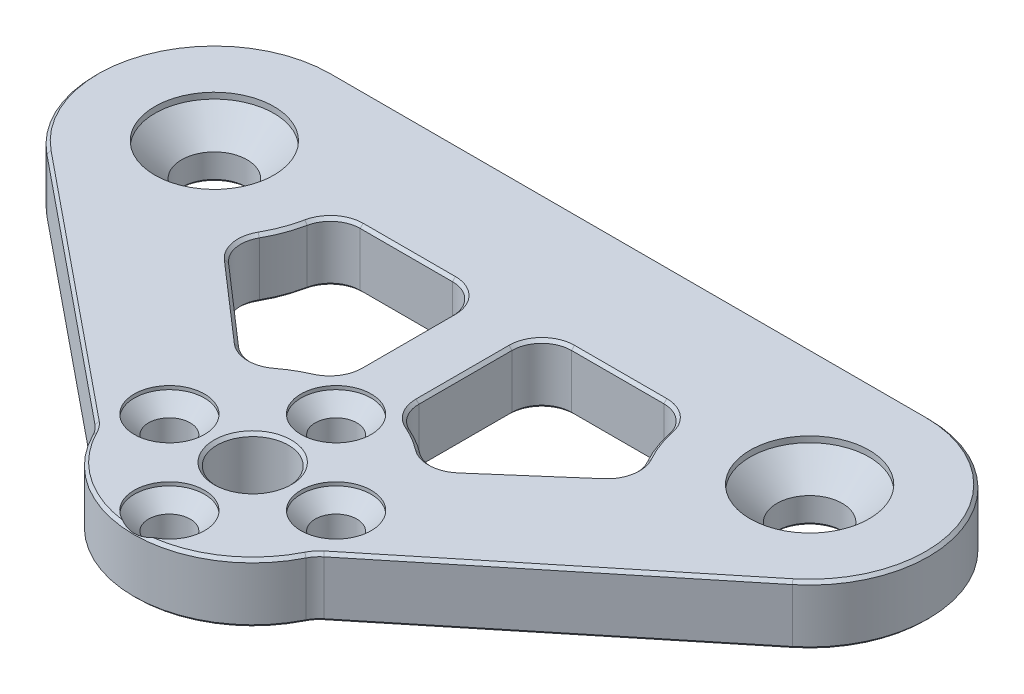
from build123d import *

# Parameters (mm, degrees)
SKETCH1_R                                      = 1.75
SKETCH1_R_2                                    = 3
SKETCH1_R_3                                    = 2.75
BOSS_EXTRUDE1_DEPTH                            = 5
CSK_FOR_M3_FLAT_HEAD_MACHINE_SCREW2_AT_2_COUNT = 2
CSK_FOR_M3_FLAT_HEAD_MACHINE_SCREW2_AT_2_PITCH = 9.899494937
CSK_FOR_M3_FLAT_HEAD_MACHINE_SCREW2_AT_3_COUNT = 2
CSK_FOR_M3_FLAT_HEAD_MACHINE_SCREW2_AT_3_PITCH = 14
CSK_FOR_M3_FLAT_HEAD_MACHINE_SCREW2_AT_4_COUNT = 2
CSK_FOR_M3_FLAT_HEAD_MACHINE_SCREW2_AT_4_PITCH = 9.899494937
CSK_FOR_M5_FLAT_HEAD_MACHINE_SCREW1_AT_2_COUNT = 2
CSK_FOR_M5_FLAT_HEAD_MACHINE_SCREW1_AT_2_PITCH = 50
CUT_EXTRUDE1_REACH                             = 49.538
FILLET1_R                                      = 2.5
CHAMFER1_SIZE                                  = 0.25


with BuildPart() as part:
    # Sketch1 → Boss-Extrude1 (new body)
    with BuildSketch(Plane(origin=(0, 0, 0), x_dir=(1, 0, 0), z_dir=(0, 1, 0))):
        with BuildLine():
            Line((-31.31164637, 14.021149308), (-9.16515139, -4))
            ThreePointArc((-9.16515139, -4), (0, -10), (9.16515139, -4))
            Line((9.16515139, -4), (31.31164637, 14.021149308))
            ThreePointArc((31.31164637, 14.021149308), (34.422443659, 25.126900143), (25, 31.777638212))
            Line((25, 31.777638212), (-25, 31.777638212))
            ThreePointArc((-25, 31.777638212), (-34.422443659, 25.126900143), (-31.31164637, 14.021149308))
        make_face()
        with Locations(Location((0, 7, 0), (0, 0, 270))):
            Circle(SKETCH1_R, mode=Mode.SUBTRACT)
        with Locations(Location((7, 0, 0), (0, 0, 270))):
            Circle(SKETCH1_R, mode=Mode.SUBTRACT)
        with Locations(Location((0, -7, 0), (0, 0, 270))):
            Circle(SKETCH1_R, mode=Mode.SUBTRACT)
        with Locations(Location((-7, 0, 0), (0, 0, 270))):
            Circle(SKETCH1_R, mode=Mode.SUBTRACT)
        with Locations(Location((0, 0, 0), (0, 0, 270))):
            Circle(SKETCH1_R_2, mode=Mode.SUBTRACT)
        with Locations(Location((-25, 21.777638212, 0), (0, 0, 270))):
            Circle(SKETCH1_R_3, mode=Mode.SUBTRACT)
        with Locations(Location((25, 21.777638212, 0), (0, 0, 90))):
            Circle(SKETCH1_R_3, mode=Mode.SUBTRACT)
    extrude(amount=BOSS_EXTRUDE1_DEPTH)

    # Sketch3 → CSK for M3 Flat Head Machine Screw2 (revolve, cut)
    with BuildSketch(Plane(origin=(0, 5, -7), x_dir=(0, 0, 1), z_dir=(1, 0, 0))):
        Polygon((0, 0), (0, 5), (1.75, 5), (1.75, 1.5), (2.95, 0.3), (2.95, 0), align=None)
    csk_for_m3_flat_head_machine_screw2 = revolve(axis=Axis((0, 11.35, -7), (0, -1, 0)), mode=Mode.SUBTRACT)

    # CSK for M3 Flat Head Machine Screw2 at 2: CSK for M3 Flat Head Machine Screw2 ×2
    with Locations(*[Vector(0.7071067811865479, 0, 0.7071067811865472) * (i * CSK_FOR_M3_FLAT_HEAD_MACHINE_SCREW2_AT_2_PITCH) for i in range(1, CSK_FOR_M3_FLAT_HEAD_MACHINE_SCREW2_AT_2_COUNT)]):
        add(csk_for_m3_flat_head_machine_screw2, mode=Mode.SUBTRACT)

    # CSK for M3 Flat Head Machine Screw2 at 3: CSK for M3 Flat Head Machine Screw2 ×2
    with Locations(*[(0, 0, i * CSK_FOR_M3_FLAT_HEAD_MACHINE_SCREW2_AT_3_PITCH) for i in range(1, CSK_FOR_M3_FLAT_HEAD_MACHINE_SCREW2_AT_3_COUNT)]):
        add(csk_for_m3_flat_head_machine_screw2, mode=Mode.SUBTRACT)

    # CSK for M3 Flat Head Machine Screw2 at 4: CSK for M3 Flat Head Machine Screw2 ×2
    with Locations(*[Vector(-0.7071067811865476, 0, 0.7071067811865476) * (i * CSK_FOR_M3_FLAT_HEAD_MACHINE_SCREW2_AT_4_PITCH) for i in range(1, CSK_FOR_M3_FLAT_HEAD_MACHINE_SCREW2_AT_4_COUNT)]):
        add(csk_for_m3_flat_head_machine_screw2, mode=Mode.SUBTRACT)

    # Sketch5 → CSK for M5 Flat Head Machine Screw1 (revolve, cut)
    with BuildSketch(Plane(origin=(-25, 5, -21.777638212), x_dir=(0, 0, 1), z_dir=(1, 0, 0))):
        Polygon((0, 0), (0, 5), (2.75, 5), (2.75, 2.75), (5, 0.5), (5, 0), align=None)
    csk_for_m5_flat_head_machine_screw1 = revolve(axis=Axis((-25, 11.35, -21.777638212), (0, -1, 0)), mode=Mode.SUBTRACT)

    # CSK for M5 Flat Head Machine Screw1 at 2: CSK for M5 Flat Head Machine Screw1 ×2
    with Locations(*[(i * CSK_FOR_M5_FLAT_HEAD_MACHINE_SCREW1_AT_2_PITCH, 0, 0) for i in range(1, CSK_FOR_M5_FLAT_HEAD_MACHINE_SCREW1_AT_2_COUNT)]):
        add(csk_for_m5_flat_head_machine_screw1, mode=Mode.SUBTRACT)

    # Sketch6 → Cut-Extrude1 (cut, up to next)
    with BuildSketch(Plane(origin=(0, 5, 0), x_dir=(1, 0, 0), z_dir=(0, 1, 0)), mode=Mode.PRIVATE) as cut_extrude1_sk1:
        with BuildLine():
            Line((-2.5, 21.777638212), (-15, 21.777638212))
            ThreePointArc((-15, 21.777638212), (-15.635091731, 18.270717467), (-17.459698622, 15.209239995))
            Line((-17.459698622, 15.209239995), (-7.540301378, 6.568398217))
            ThreePointArc((-7.540301378, 6.568398217), (-5.256068454, 8.507275969), (-2.5, 9.682458366))
            Line((-2.5, 9.682458366), (-2.5, 21.777638212))
        make_face()
    cut_extrude1_tool1 = extrude(cut_extrude1_sk1.sketch, amount=-CUT_EXTRUDE1_REACH, mode=Mode.PRIVATE) & part.part
    # Sketch6 → Cut-Extrude1 (cut, up to next)
    with BuildSketch(Plane(origin=(0, 5, 0), x_dir=(1, 0, 0), z_dir=(0, 1, 0)), mode=Mode.PRIVATE) as cut_extrude1_sk2:
        with BuildLine():
            Line((15, 21.777638212), (2.5, 21.777638212))
            Line((2.5, 21.777638212), (2.5, 9.682458366))
            ThreePointArc((2.5, 9.682458366), (5.256068454, 8.507275969), (7.540301378, 6.568398217))
            Line((7.540301378, 6.568398217), (17.459698622, 15.209239995))
            ThreePointArc((17.459698622, 15.209239995), (15.635091731, 18.270717467), (15, 21.777638212))
        make_face()
    cut_extrude1_tool2 = extrude(cut_extrude1_sk2.sketch, amount=-CUT_EXTRUDE1_REACH, mode=Mode.PRIVATE) & part.part
    add(cut_extrude1_tool1.solids().sort_by_distance((-8.781839, 5, -15.442168))[0], mode=Mode.SUBTRACT)
    add(cut_extrude1_tool2.solids().sort_by_distance((8.781839, 5, -15.442168))[0], mode=Mode.SUBTRACT)

    # Fillet1
    fillet1_edges = [part.edges().sort_by_distance(p)[0] for p in [
        (-17.459698622, 2.5, -15.209239995),
        (-15, 2.5, -21.777638212),
        (-2.5, 2.5, -21.777638212),
        (-2.5, 2.5, -9.682458366),
        (-7.540301378, 2.5, -6.568398217),
        (9.16515139, 2.5, 4),
        (17.459698622, 2.5, -15.209239995),
        (-9.16515139, 2.5, 4),
        (7.540301378, 2.5, -6.568398217),
        (2.5, 2.5, -9.682458366),
        (2.5, 2.5, -21.777638212),
        (15, 2.5, -21.777638212),
    ]]
    fillet(fillet1_edges, radius=FILLET1_R)

    # Chamfer1
    # the kernel refuses this chamfer: 0.25 mm, written as the material it takes off along each edge
    with BuildSketch(Plane(origin=(9.608207523, 0, 3.639474295), x_dir=(-0.6309260042751522, -0.027495876610586438, -0.7753556305972157), z_dir=(0.7756488903254193, 0, -0.6311646369505708)), Plane(origin=(-31.31164637, 5, -14.021149308), x_dir=(-0.017354424978555043, -0.999621916911297, 0.02132714618152181), z_dir=(0.7756488903254194, 0, 0.6311646369505706))) as chamfer1_piece_1:
        Polygon((CHAMFER1_SIZE * 0.999621916911, CHAMFER1_SIZE * 0.0274958766106), (-CHAMFER1_SIZE * 0.0274958766106, CHAMFER1_SIZE * 0.999621916911), (0, 0), align=None)
    extrude(amount=27.981009342, mode=Mode.SUBTRACT)
    with BuildSketch(Plane(origin=(9.608207523, 5, 3.639474295), x_dir=(-0.6309260042751522, 0.02749587661058563, -0.7753556305972157), z_dir=(0.7756488903254193, 0, -0.6311646369505708)), Plane(origin=(-31.31164637, 0, -14.021149308), x_dir=(-0.01735442497855503, 0.9996219169112968, 0.021327146181521792), z_dir=(0.7756488903254194, 0, 0.6311646369505706))) as chamfer1_piece_2:
        Polygon((CHAMFER1_SIZE * 0.999621916911, -CHAMFER1_SIZE * 0.0274958766106), (-CHAMFER1_SIZE * 0.0274958766106, -CHAMFER1_SIZE * 0.999621916911), (0, 0), align=None)
    extrude(amount=27.981009342, mode=Mode.SUBTRACT)
    with BuildSketch(Plane(origin=(0, 0, 0), x_dir=(-0.8948895292297137, 0, 0.44628772162700336), z_dir=(-0.44628772162700336, 0, -0.8948895292297137))) as chamfer1_piece_3:
        Polygon((10 - CHAMFER1_SIZE, 0), (10, CHAMFER1_SIZE), (10, 0), align=None)
    revolve(axis=Axis((0, 0, 0), (0, 1, 0)), revolution_arc=126.988487407, mode=Mode.SUBTRACT)
    with BuildSketch(Plane(origin=(0, 5, 0), x_dir=(-0.8948895292297137, 0, 0.44628772162700336), z_dir=(-0.44628772162700336, 0, -0.8948895292297137))) as chamfer1_piece_4:
        Polygon((10 - CHAMFER1_SIZE, 0), (10, -CHAMFER1_SIZE), (10, 0), align=None)
    revolve(axis=Axis((0, 5, 0), (0, 1, 0)), revolution_arc=126.988487407, mode=Mode.SUBTRACT)
    with BuildSketch(Plane(origin=(12.752551286, 5, -21.777638212), x_dir=(0, 0.02749587661058574, -0.9996219169112968), z_dir=(-1, 0, 0)), Plane(origin=(5, 0, -21.777638212), x_dir=(0, -0.027495876610586483, -0.9996219169112968), z_dir=(1, 0, 0)), Plane(origin=(-5, 5, -21.777638212), x_dir=(0, 0.02749587661058574, -0.9996219169112968), z_dir=(-1, 0, 0)), Plane(origin=(-12.752551286, 0, -21.777638212), x_dir=(0, -0.027495876610586483, -0.9996219169112968), z_dir=(1, 0, 0))) as chamfer1_piece_5:
        Polygon((CHAMFER1_SIZE * 0.999621916911, CHAMFER1_SIZE * 0.0274958766106), (-CHAMFER1_SIZE * 0.0274958766106, CHAMFER1_SIZE * 0.999621916911), (0, 0), align=None)
    extrude(amount=7.752551286, mode=Mode.SUBTRACT)
    with BuildSketch(Plane(origin=(25, 0, -21.777638212), x_dir=(-0.9797958971132712, 0, 0.2000000000000005), z_dir=(-0.2000000000000005, 0, -0.9797958971132712))) as chamfer1_piece_6:
        Polygon((10 - CHAMFER1_SIZE, 0), (10, CHAMFER1_SIZE), (10, 0), align=None)
    revolve(axis=Axis((25, 0, -21.777638212), (0, 1, 0)), revolution_arc=17.985384569, mode=Mode.SUBTRACT)
    with BuildSketch(Plane(origin=(25, 5, -21.777638212), x_dir=(-0.8701635996316405, 0, 0.49276293476285926), z_dir=(0.49276293476285926, 0, 0.8701635996316405))) as chamfer1_piece_7:
        Polygon((10 - CHAMFER1_SIZE, 0), (10, CHAMFER1_SIZE), (10, 0), align=None)
    revolve(axis=Axis((25, 5, -21.777638212), (0, -1, 0)), revolution_arc=17.985384569, mode=Mode.SUBTRACT)
    with BuildSketch(Plane(origin=(9.234945441, 5, -8.044612029), x_dir=(0.656591481627917, 0.02749587661058574, 0.7537450517403561), z_dir=(0.7540301377838249, 0, -0.6568398216564723)), Plane(origin=(15.765054559, 0, -13.733026183), x_dir=(0.656591481627917, -0.027495876610584825, 0.7537450517403561), z_dir=(-0.7540301377838249, 0, 0.6568398216564723)), Plane(origin=(-15.765054559, 5, -13.733026183), x_dir=(-0.656591481627917, 0.02749587661058574, 0.7537450517403562), z_dir=(0.7540301377838249, 0, 0.6568398216564721)), Plane(origin=(-9.234945441, 0, -8.044612029), x_dir=(-0.656591481627917, -0.027495876610586414, 0.7537450517403562), z_dir=(-0.7540301377838249, 0, -0.6568398216564721))) as chamfer1_piece_8:
        Polygon((CHAMFER1_SIZE * 0.999621916911, CHAMFER1_SIZE * 0.0274958766106), (-CHAMFER1_SIZE * 0.0274958766106, CHAMFER1_SIZE * 0.999621916911), (0, 0), align=None)
    extrude(amount=8.660276016, mode=Mode.SUBTRACT)
    with BuildSketch(Plane(origin=(0, 5, 0), x_dir=(0.4000000000000007, 0, -0.9165151389911678), z_dir=(-0.9165151389911678, 0, -0.4000000000000007))) as chamfer1_piece_9:
        Polygon((10 - CHAMFER1_SIZE, 0), (10, CHAMFER1_SIZE), (10, 0), align=None)
    revolve(axis=Axis((0, 5, 0), (0, -1, 0)), revolution_arc=13.825559854, mode=Mode.SUBTRACT)
    with BuildSketch(Plane(origin=(0, 0, 0), x_dir=(0.6074276709690519, 0, -0.7943749898763891), z_dir=(0.7943749898763891, 0, 0.6074276709690519))) as chamfer1_piece_10:
        Polygon((10 - CHAMFER1_SIZE, 0), (10, CHAMFER1_SIZE), (10, 0), align=None)
    revolve(axis=Axis((0, 0, 0), (0, 1, 0)), revolution_arc=13.825559854, mode=Mode.SUBTRACT)
    with BuildSketch(Plane(origin=(2.5, 5, -19.277638212), x_dir=(-0.9996219169112968, 0.027495876610585647, 0), z_dir=(0, 0, 1)), Plane(origin=(2.5, 0, -11.456439237), x_dir=(-0.9996219169112968, -0.02749587661058639, 0), z_dir=(0, 0, -1)), Plane(origin=(-2.5, 0, -19.277638212), x_dir=(0.9996219169112968, -0.02749587661058639, 0), z_dir=(0, 0, 1)), Plane(origin=(-2.5, 5, -11.456439237), x_dir=(0.9996219169112968, 0.027495876610585647, 0), z_dir=(0, 0, -1))) as chamfer1_piece_11:
        Polygon((CHAMFER1_SIZE * 0.999621916911, CHAMFER1_SIZE * 0.0274958766106), (-CHAMFER1_SIZE * 0.0274958766106, CHAMFER1_SIZE * 0.999621916911), (0, 0), align=None)
    extrude(amount=7.821198974, mode=Mode.SUBTRACT)
    with BuildSketch(Plane(origin=(0, 5, 0), x_dir=(-0.6074276709690513, 0, -0.7943749898763894), z_dir=(-0.7943749898763894, 0, 0.6074276709690513))) as chamfer1_piece_12:
        Polygon((10 - CHAMFER1_SIZE, 0), (10, CHAMFER1_SIZE), (10, 0), align=None)
    revolve(axis=Axis((0, 5, 0), (0, -1, 0)), revolution_arc=13.825559854, mode=Mode.SUBTRACT)
    with BuildSketch(Plane(origin=(0, 0, 0), x_dir=(-0.4000000000000002, 0, -0.9165151389911679), z_dir=(0.9165151389911679, 0, -0.4000000000000002))) as chamfer1_piece_13:
        Polygon((10 - CHAMFER1_SIZE, 0), (10, CHAMFER1_SIZE), (10, 0), align=None)
    revolve(axis=Axis((0, 0, 0), (0, 1, 0)), revolution_arc=13.825559854, mode=Mode.SUBTRACT)
    with BuildSketch(Plane(origin=(-25, 5, -21.777638212), x_dir=(0.9797958971132713, 0, 0.19999999999999968), z_dir=(0.19999999999999968, 0, -0.9797958971132713))) as chamfer1_piece_14:
        Polygon((10 - CHAMFER1_SIZE, 0), (10, CHAMFER1_SIZE), (10, 0), align=None)
    revolve(axis=Axis((-25, 5, -21.777638212), (0, -1, 0)), revolution_arc=17.985384569, mode=Mode.SUBTRACT)
    with BuildSketch(Plane(origin=(-25, 0, -21.777638212), x_dir=(0.8701635996316408, 0, 0.49276293476285904), z_dir=(-0.49276293476285904, 0, 0.8701635996316408))) as chamfer1_piece_15:
        Polygon((10 - CHAMFER1_SIZE, 0), (10, CHAMFER1_SIZE), (10, 0), align=None)
    revolve(axis=Axis((-25, 0, -21.777638212), (0, 1, 0)), revolution_arc=17.985384569, mode=Mode.SUBTRACT)
    with BuildSketch(Plane(origin=(11.186119115, 0, 5.57859652), x_dir=(-0.8948895292297134, 0, -0.4462877216270036), z_dir=(-0.4462877216270036, 0, 0.8948895292297134))) as chamfer1_piece_16:
        Polygon((2.5 + CHAMFER1_SIZE, 0), (2.5, -CHAMFER1_SIZE), (2.5, 0), align=None)
    revolve(axis=Axis((11.186119115, 0, 5.57859652), (0, -1, 0)), revolution_arc=24.358144003, mode=Mode.SUBTRACT)
    with BuildSketch(Plane(origin=(11.186119115, 5, 5.57859652), x_dir=(-0.8948895292297134, 0, -0.4462877216270036), z_dir=(-0.4462877216270036, 0, 0.8948895292297134))) as chamfer1_piece_17:
        Polygon((2.5 + CHAMFER1_SIZE, 0), (2.5, CHAMFER1_SIZE), (2.5, 0), align=None)
    revolve(axis=Axis((11.186119115, 5, 5.57859652), (0, -1, 0)), revolution_arc=24.358144003, mode=Mode.SUBTRACT)
    with BuildSketch(Plane(origin=(-11.186119115, 0, 5.57859652), x_dir=(0.6311646369505725, 0, -0.7756488903254177), z_dir=(-0.7756488903254177, 0, -0.6311646369505725))) as chamfer1_piece_18:
        Polygon((2.5 + CHAMFER1_SIZE, 0), (2.5, -CHAMFER1_SIZE), (2.5, 0), align=None)
    revolve(axis=Axis((-11.186119115, 0, 5.57859652), (0, -1, 0)), revolution_arc=24.358144003, mode=Mode.SUBTRACT)
    with BuildSketch(Plane(origin=(-11.186119115, 5, 5.57859652), x_dir=(0.6311646369505725, 0, -0.7756488903254177), z_dir=(-0.7756488903254177, 0, -0.6311646369505725))) as chamfer1_piece_19:
        Polygon((2.5, CHAMFER1_SIZE), (2.5 + CHAMFER1_SIZE, 0), (2.5, 0), align=None)
    revolve(axis=Axis((-11.186119115, 5, 5.57859652), (0, -1, 0)), revolution_arc=24.358144003, mode=Mode.SUBTRACT)
    with BuildSketch(Plane(origin=(12.752551286, 5, -19.277638212), x_dir=(0.979795897113271, 0, -0.20000000000000145), z_dir=(0.20000000000000145, 0, 0.979795897113271))) as chamfer1_piece_20:
        Polygon((2.5 + CHAMFER1_SIZE, 0), (2.5, -CHAMFER1_SIZE), (2.5, 0), align=None)
    revolve(axis=Axis((12.752551286, 5, -19.277638212), (0, 1, 0)), revolution_arc=78.463040967, mode=Mode.SUBTRACT)
    with BuildSketch(Plane(origin=(12.752551286, 0, -19.277638212), x_dir=(0.979795897113271, 0, -0.20000000000000145), z_dir=(0.20000000000000145, 0, 0.979795897113271))) as chamfer1_piece_21:
        Polygon((2.5 + CHAMFER1_SIZE, 0), (2.5, CHAMFER1_SIZE), (2.5, 0), align=None)
    revolve(axis=Axis((12.752551286, 0, -19.277638212), (0, 1, 0)), revolution_arc=78.463040967, mode=Mode.SUBTRACT)
    with BuildSketch(Plane(origin=(14.122955005, 5, -15.618101527), x_dir=(0.870163599631641, 0, -0.4927629347628583), z_dir=(-0.4927629347628583, 0, -0.870163599631641))) as chamfer1_piece_22:
        Polygon((2.5 + CHAMFER1_SIZE, 0), (2.5, CHAMFER1_SIZE), (2.5, 0), align=None)
    revolve(axis=Axis((14.122955005, 5, -15.618101527), (0, -1, 0)), revolution_arc=78.463040967, mode=Mode.SUBTRACT)
    with BuildSketch(Plane(origin=(14.122955005, 0, -15.618101527), x_dir=(0.870163599631641, 0, -0.4927629347628583), z_dir=(-0.4927629347628583, 0, -0.870163599631641))) as chamfer1_piece_23:
        Polygon((2.5 + CHAMFER1_SIZE, 0), (2.5, -CHAMFER1_SIZE), (2.5, 0), align=None)
    revolve(axis=Axis((14.122955005, 0, -15.618101527), (0, -1, 0)), revolution_arc=78.463040967, mode=Mode.SUBTRACT)
    with BuildSketch(Plane(origin=(7.592845887, 5, -9.929687373), x_dir=(-0.6074276709690517, 0, 0.7943749898763892), z_dir=(-0.7943749898763892, 0, -0.6074276709690517))) as chamfer1_piece_24:
        Polygon((2.5 + CHAMFER1_SIZE, 0), (2.5, -CHAMFER1_SIZE), (2.5, 0), align=None)
    revolve(axis=Axis((7.592845887, 5, -9.929687373), (0, 1, 0)), revolution_arc=78.463040967, mode=Mode.SUBTRACT)
    with BuildSketch(Plane(origin=(7.592845887, 0, -9.929687373), x_dir=(-0.6074276709690516, 0, 0.7943749898763894), z_dir=(-0.7943749898763894, 0, -0.6074276709690516))) as chamfer1_piece_25:
        Polygon((2.5 + CHAMFER1_SIZE, 0), (2.5, CHAMFER1_SIZE), (2.5, 0), align=None)
    revolve(axis=Axis((7.592845887, 0, -9.929687373), (0, 1, 0)), revolution_arc=78.463040967, mode=Mode.SUBTRACT)
    with BuildSketch(Plane(origin=(5, 5, -11.456439237), x_dir=(-1, 0, 0), z_dir=(0, 0, -1))) as chamfer1_piece_26:
        Polygon((2.5 + CHAMFER1_SIZE, 0), (2.5, -CHAMFER1_SIZE), (2.5, 0), align=None)
    revolve(axis=Axis((5, 5, -11.456439237), (0, 1, 0)), revolution_arc=66.421821522, mode=Mode.SUBTRACT)
    with BuildSketch(Plane(origin=(5, 0, -11.456439237), x_dir=(-1, 0, 0), z_dir=(0, 0, -1))) as chamfer1_piece_27:
        Polygon((2.5 + CHAMFER1_SIZE, 0), (2.5, CHAMFER1_SIZE), (2.5, 0), align=None)
    revolve(axis=Axis((5, 0, -11.456439237), (0, 1, 0)), revolution_arc=66.421821522, mode=Mode.SUBTRACT)
    with BuildSketch(Plane(origin=(5, 5, -19.277638212), x_dir=(0, 0, -1), z_dir=(1, 0, 0))) as chamfer1_piece_28:
        Polygon((2.5 + CHAMFER1_SIZE, 0), (2.5, -CHAMFER1_SIZE), (2.5, 0), align=None)
    revolve(axis=Axis((5, 5, -19.277638212), (0, 1, 0)), revolution_arc=90, mode=Mode.SUBTRACT)
    with BuildSketch(Plane(origin=(5, 0, -19.277638212), x_dir=(0, 0, -1), z_dir=(1, 0, 0))) as chamfer1_piece_29:
        Polygon((2.5 + CHAMFER1_SIZE, 0), (2.5, CHAMFER1_SIZE), (2.5, 0), align=None)
    revolve(axis=Axis((5, 0, -19.277638212), (0, 1, 0)), revolution_arc=90, mode=Mode.SUBTRACT)
    with BuildSketch(Plane(origin=(-5, 5, -19.277638212), x_dir=(0, 0, -1), z_dir=(-1, 0, 0))) as chamfer1_piece_30:
        Polygon((2.5 + CHAMFER1_SIZE, 0), (2.5, CHAMFER1_SIZE), (2.5, 0), align=None)
    revolve(axis=Axis((-5, 5, -19.277638212), (0, -1, 0)), revolution_arc=90, mode=Mode.SUBTRACT)
    with BuildSketch(Plane(origin=(-5, 0, -19.277638212), x_dir=(0, 0, -1), z_dir=(-1, 0, 0))) as chamfer1_piece_31:
        Polygon((2.5 + CHAMFER1_SIZE, 0), (2.5, -CHAMFER1_SIZE), (2.5, 0), align=None)
    revolve(axis=Axis((-5, 0, -19.277638212), (0, -1, 0)), revolution_arc=90, mode=Mode.SUBTRACT)
    with BuildSketch(Plane(origin=(0, 0, -7), x_dir=(0, 0, 1), z_dir=(-1, 0, 0))) as chamfer1_piece_32:
        Polygon((1.75 + CHAMFER1_SIZE, 0), (1.75, CHAMFER1_SIZE), (1.75, 0), align=None)
    revolve(axis=Axis((0, 0, -7), (0, 1, 0)), mode=Mode.SUBTRACT)
    with BuildSketch(Plane(origin=(-5, 5, -11.456439237), x_dir=(0.40000000000000024, 0, 0.916515138991168), z_dir=(-0.916515138991168, 0, 0.40000000000000024))) as chamfer1_piece_33:
        Polygon((2.5 + CHAMFER1_SIZE, 0), (2.5, -CHAMFER1_SIZE), (2.5, 0), align=None)
    revolve(axis=Axis((-5, 5, -11.456439237), (0, 1, 0)), revolution_arc=66.421821522, mode=Mode.SUBTRACT)
    with BuildSketch(Plane(origin=(-5, 0, -11.456439237), x_dir=(0.4000000000000005, 0, 0.9165151389911678), z_dir=(-0.9165151389911678, 0, 0.4000000000000005))) as chamfer1_piece_34:
        Polygon((2.5 + CHAMFER1_SIZE, 0), (2.5, CHAMFER1_SIZE), (2.5, 0), align=None)
    revolve(axis=Axis((-5, 0, -11.456439237), (0, 1, 0)), revolution_arc=66.421821522, mode=Mode.SUBTRACT)
    with BuildSketch(Plane(origin=(-7.592845887, 5, -9.929687373), x_dir=(-0.6568398216564721, 0, 0.7540301377838249), z_dir=(-0.7540301377838249, 0, -0.6568398216564721))) as chamfer1_piece_35:
        Polygon((2.5 + CHAMFER1_SIZE, 0), (2.5, -CHAMFER1_SIZE), (2.5, 0), align=None)
    revolve(axis=Axis((-7.592845887, 5, -9.929687373), (0, 1, 0)), revolution_arc=78.463040967, mode=Mode.SUBTRACT)
    with BuildSketch(Plane(origin=(-7.592845887, 0, -9.929687373), x_dir=(-0.6568398216564725, 0, 0.7540301377838244), z_dir=(-0.7540301377838244, 0, -0.6568398216564725))) as chamfer1_piece_36:
        Polygon((2.5 + CHAMFER1_SIZE, 0), (2.5, CHAMFER1_SIZE), (2.5, 0), align=None)
    revolve(axis=Axis((-7.592845887, 0, -9.929687373), (0, 1, 0)), revolution_arc=78.463040967, mode=Mode.SUBTRACT)
    with BuildSketch(Plane(origin=(-14.122955005, 5, -15.618101527), x_dir=(-0.8701635996316401, 0, -0.4927629347628601), z_dir=(0.4927629347628601, 0, -0.8701635996316401))) as chamfer1_piece_37:
        Polygon((2.5 + CHAMFER1_SIZE, 0), (2.5, -CHAMFER1_SIZE), (2.5, 0), align=None)
    revolve(axis=Axis((-14.122955005, 5, -15.618101527), (0, 1, 0)), revolution_arc=78.463040967, mode=Mode.SUBTRACT)
    with BuildSketch(Plane(origin=(-14.122955005, 0, -15.618101527), x_dir=(-0.8701635996316401, 0, -0.4927629347628601), z_dir=(0.4927629347628601, 0, -0.8701635996316401))) as chamfer1_piece_38:
        Polygon((2.5 + CHAMFER1_SIZE, 0), (2.5, CHAMFER1_SIZE), (2.5, 0), align=None)
    revolve(axis=Axis((-14.122955005, 0, -15.618101527), (0, 1, 0)), revolution_arc=78.463040967, mode=Mode.SUBTRACT)
    with BuildSketch(Plane(origin=(-12.752551286, 5, -19.277638212), x_dir=(0, 0, -1), z_dir=(1, 0, 0))) as chamfer1_piece_39:
        Polygon((2.5 + CHAMFER1_SIZE, 0), (2.5, -CHAMFER1_SIZE), (2.5, 0), align=None)
    revolve(axis=Axis((-12.752551286, 5, -19.277638212), (0, 1, 0)), revolution_arc=78.463040967, mode=Mode.SUBTRACT)
    with BuildSketch(Plane(origin=(-12.752551286, 0, -19.277638212), x_dir=(0, 0, -1), z_dir=(1, 0, 0))) as chamfer1_piece_40:
        Polygon((2.5 + CHAMFER1_SIZE, 0), (2.5, CHAMFER1_SIZE), (2.5, 0), align=None)
    revolve(axis=Axis((-12.752551286, 0, -19.277638212), (0, 1, 0)), revolution_arc=78.463040967, mode=Mode.SUBTRACT)
    with BuildSketch(Plane(origin=(7, 0, 0), x_dir=(0, 0, 1), z_dir=(-1, 0, 0))) as chamfer1_piece_41:
        Polygon((1.75 + CHAMFER1_SIZE, 0), (1.75, CHAMFER1_SIZE), (1.75, 0), align=None)
    revolve(axis=Axis((7, 0, 0), (0, 1, 0)), mode=Mode.SUBTRACT)
    with BuildSketch(Plane(origin=(25, 5, -21.777638212), x_dir=(0.6311646369505718, 0, 0.7756488903254183), z_dir=(-0.7756488903254183, 0, 0.6311646369505718))) as chamfer1_piece_42:
        Polygon((10 - CHAMFER1_SIZE, 0), (10, -CHAMFER1_SIZE), (10, 0), align=None)
    revolve(axis=Axis((25, 5, -21.777638212), (0, 1, 0)), revolution_arc=140.8639003, mode=Mode.SUBTRACT)
    with BuildSketch(Plane(origin=(0, 0, 7), x_dir=(0, 0, 1), z_dir=(-1, 0, 0))) as chamfer1_piece_43:
        Polygon((1.75 + CHAMFER1_SIZE, 0), (1.75, CHAMFER1_SIZE), (1.75, 0), align=None)
    revolve(axis=Axis((0, 0, 7), (0, 1, 0)), mode=Mode.SUBTRACT)
    with BuildSketch(Plane(origin=(25, 5, -31.777638212), x_dir=(0, 0.02749587661058574, 0.9996219169112968), z_dir=(-1, 0, 0))) as chamfer1_piece_44:
        Polygon((CHAMFER1_SIZE * 0.999621916911, -CHAMFER1_SIZE * 0.0274958766106), (-CHAMFER1_SIZE * 0.0274958766106, -CHAMFER1_SIZE * 0.999621916911), (0, 0), align=None)
    extrude(amount=50, mode=Mode.SUBTRACT)
    with BuildSketch(Plane(origin=(-7, 0, 0), x_dir=(0, 0, 1), z_dir=(-1, 0, 0))) as chamfer1_piece_45:
        Polygon((1.75 + CHAMFER1_SIZE, 0), (1.75, CHAMFER1_SIZE), (1.75, 0), align=None)
    revolve(axis=Axis((-7, 0, 0), (0, 1, 0)), mode=Mode.SUBTRACT)
    with BuildSketch(Plane(origin=(0, 0, 0), x_dir=(0, 0, 1), z_dir=(-1, 0, 0))) as chamfer1_piece_46:
        Polygon((3 + CHAMFER1_SIZE, 0), (3, CHAMFER1_SIZE), (3, 0), align=None)
    revolve(axis=Axis((0, 0, 0), (0, 1, 0)), mode=Mode.SUBTRACT)
    with BuildSketch(Plane(origin=(0, 5, 0), x_dir=(0, 0, 1), z_dir=(-1, 0, 0))) as chamfer1_piece_47:
        Polygon((3 + CHAMFER1_SIZE, 0), (3, -CHAMFER1_SIZE), (3, 0), align=None)
    revolve(axis=Axis((0, 5, 0), (0, 1, 0)), mode=Mode.SUBTRACT)
    with BuildSketch(Plane(origin=(-25, 0, -21.777638212), x_dir=(0, 0, 1), z_dir=(-1, 0, 0))) as chamfer1_piece_48:
        Polygon((2.75 + CHAMFER1_SIZE, 0), (2.75, CHAMFER1_SIZE), (2.75, 0), align=None)
    revolve(axis=Axis((-25, 0, -21.777638212), (0, 1, 0)), mode=Mode.SUBTRACT)
    with BuildSketch(Plane(origin=(25, 0, -21.777638212), x_dir=(0, 0, -1), z_dir=(1, 0, 0))) as chamfer1_piece_49:
        Polygon((2.75 + CHAMFER1_SIZE, 0), (2.75, CHAMFER1_SIZE), (2.75, 0), align=None)
    revolve(axis=Axis((25, 0, -21.777638212), (0, 1, 0)), mode=Mode.SUBTRACT)
    with BuildSketch(Plane(origin=(-25, 5, -21.777638212), x_dir=(0, 0, -1), z_dir=(1, 0, 0))) as chamfer1_piece_50:
        Polygon((10, -CHAMFER1_SIZE), (10 - CHAMFER1_SIZE, 0), (10, 0), align=None)
    revolve(axis=Axis((-25, 5, -21.777638212), (0, 1, 0)), revolution_arc=140.8639003, mode=Mode.SUBTRACT)
    with BuildSketch(Plane(origin=(25, 0, -31.777638212), x_dir=(0, -0.027495876610586483, 0.9996219169112968), z_dir=(-1, 0, 0))) as chamfer1_piece_51:
        Polygon((CHAMFER1_SIZE * 0.999621916911, CHAMFER1_SIZE * 0.0274958766106), (-CHAMFER1_SIZE * 0.0274958766106, CHAMFER1_SIZE * 0.999621916911), (0, 0), align=None)
    extrude(amount=50, mode=Mode.SUBTRACT)
    with BuildSketch(Plane(origin=(25, 0, -21.777638212), x_dir=(0.6311646369505718, 0, 0.7756488903254183), z_dir=(-0.7756488903254183, 0, 0.6311646369505718))) as chamfer1_piece_52:
        Polygon((10 - CHAMFER1_SIZE, 0), (10, CHAMFER1_SIZE), (10, 0), align=None)
    revolve(axis=Axis((25, 0, -21.777638212), (0, 1, 0)), revolution_arc=140.8639003, mode=Mode.SUBTRACT)
    with BuildSketch(Plane(origin=(-25, 0, -21.777638212), x_dir=(0, 0, -1), z_dir=(1, 0, 0))) as chamfer1_piece_53:
        Polygon((10 - CHAMFER1_SIZE, 0), (10, CHAMFER1_SIZE), (10, 0), align=None)
    revolve(axis=Axis((-25, 0, -21.777638212), (0, 1, 0)), revolution_arc=140.8639003, mode=Mode.SUBTRACT)


solid = part.part
